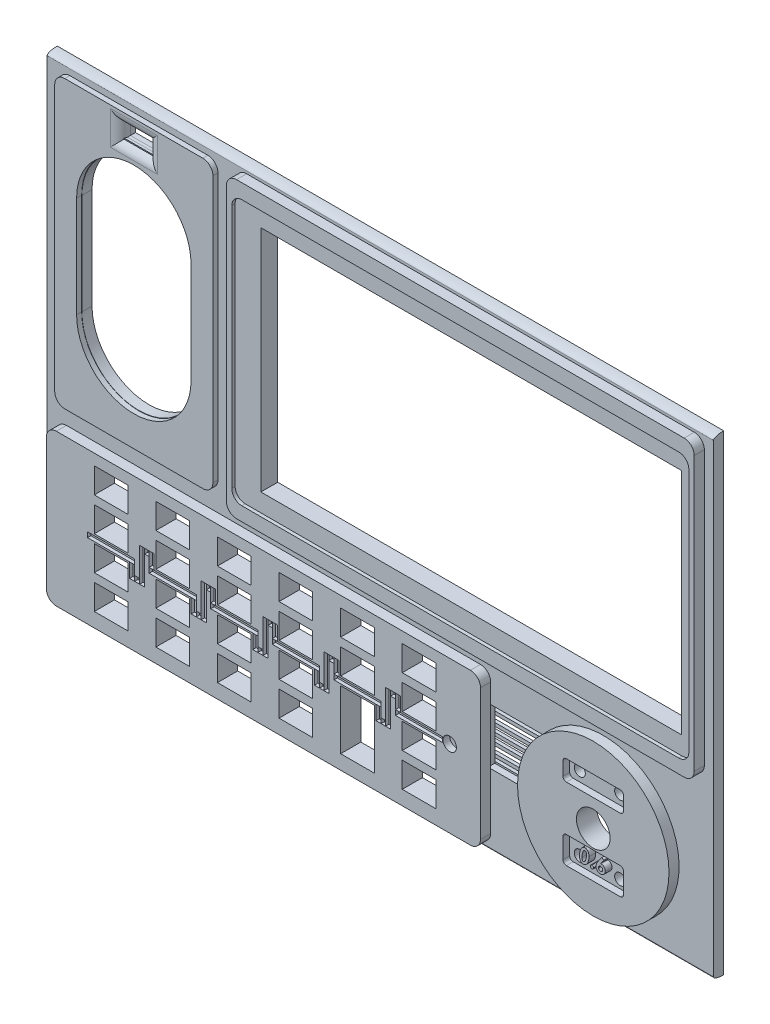
from build123d import *

# Parameters (mm, degrees)
SKETCH1_W                   = 198
SKETCH1_H                   = 140
MAIN_BODY_DEPTH             = 3
LONG_CORNERS_SIZE           = 3
LONG_CORNERS_SIZE_2         = 1
SKETCH2_W                   = 47
SKETCH2_H                   = 85
SPEAKER_DEPTH               = 1.5
SPEAKER_CORNERS_R           = 3
SPEAKER_CUT_DEPTH           = 122.331158548
SKETCH21_W                  = 43
SKETCH21_H                  = 72
SPEAKER_SLOT_DEPTH          = 3
SKETCH36_W                  = 43
SKETCH36_H                  = 0.5
SKETCH36_W_2                = 5.5
SKETCH36_W_3                = 3.5
SKETCH36_W_4                = 10
SPEAKER_PRINT_SUPPORT_DEPTH = 3
SKETCH3_W                   = 139
SKETCH3_H                   = 87.25
LCD_DEPTH                   = 3
LCD_CORNERS_R               = 3
SKETCH9_W                   = 135.8
SKETCH9_H                   = 78.75
LCD_FRONT_DEPTH             = 1
LCD_FRONT_CORNERS_R         = 3
SKETCH10_W                  = 125
SKETCH10_H                  = 68
LCD_BACK_DEPTH              = 122.396046203
SKETCH4_W                   = 129
SKETCH4_H                   = 45
KEYPAD_DEPTH                = 3
KEYPAD_CORNERS_R            = 3
SKETCH25_W                  = 10
SKETCH25_H                  = 7.5
SKETCH25_H_2                = 17.5
KEYPAD_CUTS_0_8_DEPTH       = 122.396046208
SKETCH5_R                   = 22.5
VFO_DEPTH                   = 3
SKETCH7_R                   = 5
VFO_ENCODER_KNOB_CUT_DEPTH  = 122.396046208
SKETCH37_W                  = 18
SKETCH37_H                  = 8
SKETCH37_H_2                = 6
LOGO_CUT_DEPTH              = 2
SKETCH44_R                  = 1.65
ENCODER_MOUNT_HOLES_DEPTH   = 122.396046208
ENC_CUT_CORNERS_R           = 1
LOGO_TXT_VER_DEPTH          = 2
ESP32_W                     = 18.5
ESP32_H                     = 16.5
ESP32_CAN_CUT_DEPTH         = 3
SKETCH43_W                  = 16.5
SKETCH43_H                  = 16.5
LORA_CUT_DEPTH              = 2.5
SKETCH47_W                  = 27
SKETCH47_H                  = 18.5
ESP32_EX_CUT_DEPTH          = 1
SKETCH49_W                  = 8
SKETCH49_H                  = 4
AMB_SENSOR_DEPTH            = 122.396046208
AMB_CORNERS_R               = 3
SKETCH50_W                  = 14
SKETCH50_H                  = 1.5
SKETCH50_W_2                = 1.5
SKETCH50_H_2                = 4.24
SKETCH50_H_3                = 10
SKETCH50_W_3                = 1.3
SKETCH50_W_4                = 1.45
SKETCH50_W_5                = 1.26
SKETCH50_W_6                = 1.46
LORA_ANT_DEPTH              = 1
SKETCH51_R                  = 0.5
LORA_ANT_PIN_DEPTH          = 122.396046208
SKETCH52_R                  = 2
LORA_ANT_SOLDER_DEPTH       = 2
SKETCH53_W                  = 26.5
SKETCH53_H                  = 1
ESP32_SUPPORT_DEPTH         = 1
SKETCH54_W                  = 15.995889497
SKETCH54_H                  = 0.898645477
SKETCH54_H_2                = 1.168239121
SKETCH54_H_3                = 1.033442299
SKETCH54_W_2                = 15.726295854
SKETCH54_H_4                = 1.078374573
SKETCH54_H_5                = 0.943577751
BOSS_EXTRUDE2_DEPTH         = 2.5
SKETCH55_W                  = 10
SKETCH55_H                  = 20
SKETCH55_W_2                = 22
SKETCH55_H_2                = 4
SKETCH55_W_3                = 4
SKETCH55_H_3                = 10
SKETCH55_W_4                = 3
SKETCH55_H_4                = 5
SKETCH55_W_5                = 14
SKETCH55_W_6                = 13
SKETCH55_H_5                = 3
SKETCH55_W_7                = 15
CONN_CUTOUTS_DEPTH          = 2


with BuildPart() as part:
    # Sketch1 → main_body (new body)
    with BuildSketch(Plane.XY):
        Rectangle(SKETCH1_W, SKETCH1_H)
    extrude(amount=MAIN_BODY_DEPTH)

    # long_corners
    # an asymmetric fillet: 3, 1 mm, written as the material it takes off along each edge
    with BuildSketch(Plane(origin=(-106.5, 70, 3), x_dir=(0, 0, -1), z_dir=(1, 0, 0)), Plane(origin=(106.5, -70, 3), x_dir=(0, 0, -1), z_dir=(-1, 0, 0))) as long_corners_piece_1:
        with BuildLine():
            Bezier((LONG_CORNERS_SIZE, 0), (0, 0), (0, -LONG_CORNERS_SIZE_2), weights=[1, 0.707106781, 1])
            Line((0, -LONG_CORNERS_SIZE_2), (0, 0))
            Line((0, 0), (LONG_CORNERS_SIZE, 0))
        make_face()
    extrude(amount=213, mode=Mode.SUBTRACT)

    # Sketch2 → speaker (add)
    with BuildSketch(Plane.XY.offset(3)):
        with Locations((-71.75, 24.75)):
            Rectangle(SKETCH2_W, SKETCH2_H)
    extrude(amount=SPEAKER_DEPTH)

    # speaker_corners
    speaker_corners_edges = [part.edges().sort_by_distance(p)[0] for p in [
        (-95.25, 67.25, 3.75),
        (-95.25, -17.75, 3.75),
        (-48.25, -17.75, 3.75),
        (-48.25, 67.25, 3.75),
    ]]
    fillet(speaker_corners_edges, radius=SPEAKER_CORNERS_R)

    # Sketch19 → speaker_cut (cut, through all)
    with BuildSketch(Plane.XY.offset(4.5)):
        with BuildLine():
            Line((-88.75, 8.25), (-88.75, 38.25))
            ThreePointArc((-88.75, 38.25), (-71.75, 55.25), (-54.75, 38.25))
            Line((-54.75, 38.25), (-54.75, 8.25))
            ThreePointArc((-54.75, 8.25), (-71.75, -8.75), (-88.75, 8.25))
        make_face()
    extrude(amount=-SPEAKER_CUT_DEPTH, mode=Mode.SUBTRACT)

    # Sketch21 → speaker_slot (cut)
    with BuildSketch(Plane(origin=(0, 0, 0), x_dir=(-1, 0, 0), z_dir=(0, 0, -1))):
        with Locations((71.75, 23.25)):
            Rectangle(SKETCH21_W, SKETCH21_H)
    extrude(amount=-SPEAKER_SLOT_DEPTH, mode=Mode.SUBTRACT)

    # Sketch36 → speaker_print_support (add)
    # profile 1 of 17: a face of its own
    with BuildSketch(Plane(origin=(0, 0, 3), x_dir=(-1, 0, 0), z_dir=(0, 0, -1))):
        with BuildLine():
            Line((54.25, 8.263862744), (54.25, 38.236137256))
            ThreePointArc((54.25, 38.236137256), (71.75, 55.736137256), (89.25, 38.236137256))
            Line((89.25, 38.236137256), (89.25, 8.263862744))
            ThreePointArc((89.25, 8.263862744), (71.75, -9.236137256), (54.25, 8.263862744))
        make_face()
        with BuildLine():
            Line((54.831583339, 8.263862744), (54.831583339, 38.236137256))
            ThreePointArc((54.831583339, 38.236137256), (71.75, 55.154553916), (88.668416661, 38.236137256))
            Line((88.668416661, 38.236137256), (88.668416661, 8.263862744))
            ThreePointArc((88.668416661, 8.263862744), (71.75, -8.654553916), (54.831583339, 8.263862744))
        make_face(mode=Mode.SUBTRACT)
    # profile 2 of 17: a face of its own
    with BuildSketch(Plane(origin=(0, 0, 3), x_dir=(-1, 0, 0), z_dir=(0, 0, -1))):
        with Locations((71.75, 57)):
            Rectangle(SKETCH36_W, SKETCH36_H)
    # profile 3 of 17: a face of its own
    with BuildSketch(Plane(origin=(0, 0, 3), x_dir=(-1, 0, 0), z_dir=(0, 0, -1))):
        with Locations((90.5, 0)):
            Rectangle(SKETCH36_W_2, SKETCH36_H)
    # profile 4 of 17: a face of its own
    with BuildSketch(Plane(origin=(0, 0, 3), x_dir=(-1, 0, 0), z_dir=(0, 0, -1))):
        with Locations((71.75, -10.5)):
            Rectangle(SKETCH36_W, SKETCH36_H)
    # profile 5 of 17: a face of its own
    with BuildSketch(Plane(origin=(0, 0, 3), x_dir=(-1, 0, 0), z_dir=(0, 0, -1))):
        with Locations((90.5, 46.5)):
            Rectangle(SKETCH36_W_2, SKETCH36_H)
    # profile 6 of 17: a face of its own
    with BuildSketch(Plane(origin=(0, 0, 3), x_dir=(-1, 0, 0), z_dir=(0, 0, -1))):
        with Locations((91.5, 35)):
            Rectangle(SKETCH36_W_3, SKETCH36_H)
    # profile 7 of 17: a face of its own
    with BuildSketch(Plane(origin=(0, 0, 3), x_dir=(-1, 0, 0), z_dir=(0, 0, -1))):
        with Locations((91.5, 23.5)):
            Rectangle(SKETCH36_W_3, SKETCH36_H)
    # profile 8 of 17: a face of its own
    with BuildSketch(Plane(origin=(0, 0, 3), x_dir=(-1, 0, 0), z_dir=(0, 0, -1))):
        with Locations((91.5, 11)):
            Rectangle(SKETCH36_W_3, SKETCH36_H)
    # profile 9 of 17: a face of its own
    with BuildSketch(Plane(origin=(0, 0, 3), x_dir=(-1, 0, 0), z_dir=(0, 0, -1))):
        with Locations((88.25, -5.5)):
            Rectangle(SKETCH36_W_4, SKETCH36_H)
    # profile 10 of 17: a face of its own
    with BuildSketch(Plane(origin=(0, 0, 3), x_dir=(-1, 0, 0), z_dir=(0, 0, -1))):
        with Locations((88.25, 52)):
            Rectangle(SKETCH36_W_4, SKETCH36_H)
    # profile 11 of 17: a face of its own
    with BuildSketch(Plane(origin=(0, 0, 3), x_dir=(-1, 0, 0), z_dir=(0, 0, -1))):
        with Locations((55.25, 52)):
            Rectangle(SKETCH36_W_4, SKETCH36_H)
    # profile 12 of 17: a face of its own
    with BuildSketch(Plane(origin=(0, 0, 3), x_dir=(-1, 0, 0), z_dir=(0, 0, -1))):
        with Locations((53, 46.5)):
            Rectangle(SKETCH36_W_2, SKETCH36_H)
    # profile 13 of 17: a face of its own
    with BuildSketch(Plane(origin=(0, 0, 3), x_dir=(-1, 0, 0), z_dir=(0, 0, -1))):
        with Locations((52, 35)):
            Rectangle(SKETCH36_W_3, SKETCH36_H)
    # profile 14 of 17: a face of its own
    with BuildSketch(Plane(origin=(0, 0, 3), x_dir=(-1, 0, 0), z_dir=(0, 0, -1))):
        with Locations((52, 23.5)):
            Rectangle(SKETCH36_W_3, SKETCH36_H)
    # profile 15 of 17: a face of its own
    with BuildSketch(Plane(origin=(0, 0, 3), x_dir=(-1, 0, 0), z_dir=(0, 0, -1))):
        with Locations((52, 10.5)):
            Rectangle(SKETCH36_W_3, SKETCH36_H)
    # profile 16 of 17: a face of its own
    with BuildSketch(Plane(origin=(0, 0, 3), x_dir=(-1, 0, 0), z_dir=(0, 0, -1))):
        with Locations((53, 0)):
            Rectangle(SKETCH36_W_2, SKETCH36_H)
    # profile 17 of 17: a face of its own
    with BuildSketch(Plane(origin=(0, 0, 3), x_dir=(-1, 0, 0), z_dir=(0, 0, -1))):
        with Locations((55.25, -5.5)):
            Rectangle(SKETCH36_W_4, SKETCH36_H)
    extrude(amount=SPEAKER_PRINT_SUPPORT_DEPTH)

    # Sketch3 → lcd (add)
    with BuildSketch(Plane.XY.offset(3)):
        with Locations((26.75, 24.625)):
            Rectangle(SKETCH3_W, SKETCH3_H)
    extrude(amount=LCD_DEPTH)

    # lcd_corners
    lcd_corners_edges = [part.edges().sort_by_distance(p)[0] for p in [
        (-42.75, 68.25, 4.5),
        (-42.75, -19, 4.5),
        (96.25, -19, 4.5),
        (96.25, 68.25, 4.5),
    ]]
    fillet(lcd_corners_edges, radius=LCD_CORNERS_R)

    # Sketch9 → lcd_front (cut)
    with BuildSketch(Plane.XY.offset(6)):
        with Locations((26.75, 24.5)):
            Rectangle(SKETCH9_W, SKETCH9_H)
    extrude(amount=-LCD_FRONT_DEPTH, mode=Mode.SUBTRACT)

    # lcd_front_corners
    lcd_front_corners_edges = [part.edges().sort_by_distance(p)[0] for p in [
        (-41.15, -14.875, 5.5),
        (-41.15, 63.875, 5.5),
        (94.65, 63.875, 5.5),
        (94.65, -14.875, 5.5),
    ]]
    fillet(lcd_front_corners_edges, radius=LCD_FRONT_CORNERS_R)

    # Sketch10 → lcd_back (cut, through all)
    with BuildSketch(Plane(origin=(0, 0, 0), x_dir=(-1, 0, 0), z_dir=(0, 0, -1))):
        with Locations((-29, 24.5)):
            Rectangle(SKETCH10_W, SKETCH10_H)
    extrude(amount=-LCD_BACK_DEPTH, mode=Mode.SUBTRACT)

    # Sketch4 → keypad (add)
    with BuildSketch(Plane.XY.offset(3)):
        with Locations((-31.75, -45.75)):
            Rectangle(SKETCH4_W, SKETCH4_H)
    extrude(amount=KEYPAD_DEPTH)

    # keypad_corners
    keypad_corners_edges = [part.edges().sort_by_distance(p)[0] for p in [
        (-96.25, -23.25, 4.5),
        (-96.25, -68.25, 4.5),
        (32.75, -68.25, 4.5),
        (32.75, -23.25, 4.5),
    ]]
    fillet(keypad_corners_edges, radius=KEYPAD_CORNERS_R)

    # Sketch25 → keypad_cuts_0.8 (cut, through all)
    with BuildSketch(Plane.XY.offset(6)):
        with Locations((-77, -30.25)):
            Rectangle(SKETCH25_W, SKETCH25_H)
        with Locations((-77, -40.25)):
            Rectangle(SKETCH25_W, SKETCH25_H)
        with Locations((-77, -50.25)):
            Rectangle(SKETCH25_W, SKETCH25_H)
        with Locations((-77, -60.25)):
            Rectangle(SKETCH25_W, SKETCH25_H)
        with Locations((-58.7, -30.25)):
            Rectangle(SKETCH25_W, SKETCH25_H)
        with Locations((-58.7, -40.25)):
            Rectangle(SKETCH25_W, SKETCH25_H)
        with Locations((-58.7, -50.25)):
            Rectangle(SKETCH25_W, SKETCH25_H)
        with Locations((-58.7, -60.25)):
            Rectangle(SKETCH25_W, SKETCH25_H)
        with Locations((-40.4, -30.25)):
            Rectangle(SKETCH25_W, SKETCH25_H)
        with Locations((-40.4, -40.25)):
            Rectangle(SKETCH25_W, SKETCH25_H)
        with Locations((-40.4, -50.25)):
            Rectangle(SKETCH25_W, SKETCH25_H)
        with Locations((-40.4, -60.25)):
            Rectangle(SKETCH25_W, SKETCH25_H)
        with Locations((-22.1, -30.25)):
            Rectangle(SKETCH25_W, SKETCH25_H)
        with Locations((-22.1, -40.25)):
            Rectangle(SKETCH25_W, SKETCH25_H)
        with Locations((-22.1, -50.25)):
            Rectangle(SKETCH25_W, SKETCH25_H)
        with Locations((-22.1, -60.25)):
            Rectangle(SKETCH25_W, SKETCH25_H)
        with Locations((-3.8, -30.25)):
            Rectangle(SKETCH25_W, SKETCH25_H)
        with Locations((14.5, -30.25)):
            Rectangle(SKETCH25_W, SKETCH25_H)
        with Locations((-3.8, -40.25)):
            Rectangle(SKETCH25_W, SKETCH25_H)
        with Locations((14.5, -40.25)):
            Rectangle(SKETCH25_W, SKETCH25_H)
        with Locations((14.5, -50.25)):
            Rectangle(SKETCH25_W, SKETCH25_H)
        with Locations((14.5, -60.25)):
            Rectangle(SKETCH25_W, SKETCH25_H)
        with Locations((-3.8, -55.25)):
            Rectangle(SKETCH25_W, SKETCH25_H_2)
    extrude(amount=-KEYPAD_CUTS_0_8_DEPTH, mode=Mode.SUBTRACT)

    # Sketch5 → vfo (add)
    with BuildSketch(Plane.XY.offset(3)):
        with Locations((66.25, -45.75)):
            Circle(SKETCH5_R)
    extrude(amount=VFO_DEPTH)

    # Sketch7 → vfo_encoder_knob_cut (cut, through all)
    with BuildSketch(Plane.XY.offset(6)):
        with Locations((66.25, -45.75)):
            Circle(SKETCH7_R)
    extrude(amount=-VFO_ENCODER_KNOB_CUT_DEPTH, mode=Mode.SUBTRACT)

    # Sketch37 → logo_cut (cut)
    with BuildSketch(Plane.XY.offset(6)):
        with Locations((66.25, -55.25)):
            Rectangle(SKETCH37_W, SKETCH37_H)
        with Locations((66.25, -34.75)):
            Rectangle(SKETCH37_W, SKETCH37_H_2)
    extrude(amount=-LOGO_CUT_DEPTH, mode=Mode.SUBTRACT)

    # Sketch44 → encoder_mount_holes (cut, through all)
    with BuildSketch(Plane.XY.offset(6)):
        with Locations((60.25, -34.75)):
            Circle(SKETCH44_R)
        with Locations((72.25, -34.75)):
            Circle(SKETCH44_R)
        with Locations((60.25, -56.75)):
            Circle(SKETCH44_R)
        with Locations((72.25, -56.75)):
            Circle(SKETCH44_R)
    extrude(amount=-ENCODER_MOUNT_HOLES_DEPTH, mode=Mode.SUBTRACT)

    # enc_cut_corners
    enc_cut_corners_edges = [part.edges().sort_by_distance(p)[0] for p in [
        (57.25, -59.25, 5),
        (57.25, -51.25, 5),
        (75.25, -51.25, 5),
        (75.25, -59.25, 5),
        (57.25, -37.75, 5),
        (57.25, -31.75, 5),
        (75.25, -31.75, 5),
        (75.25, -37.75, 5),
    ]]
    fillet(enc_cut_corners_edges, radius=ENC_CUT_CORNERS_R)

    # Sketch39 → logo_txt_ver (add)
    # profile 1 of 3: a face of its own
    with BuildSketch(Plane.XY.offset(4)):
        with BuildLine():
            add(Edge.make_bspline(
                [(63.848691239, -51.908119658), (63.888365435, -51.909349684), (63.966554937, -51.911773806), (64.080877258, -51.933207937), (64.190733796, -51.965674637), (64.294601546, -52.014500361), (64.394862397, -52.074304909), (64.488096326, -52.150498068), (64.577717446, -52.238076119), (64.661431722, -52.339093675), (64.73820927, -52.452802479), (64.804033758, -52.58032325), (64.861076095, -52.719494062), (64.906353871, -52.871317336), (64.94204881, -53.03516432), (64.966836856, -53.211477353), (64.98235384, -53.400079429), (64.98412922, -53.529791568), (64.985042735, -53.596534455)],
                knots=[0, 0, 0, 0, 0.836471817, 1.648510141, 2.446693269, 3.247435573, 4.063800371, 4.904091908, 5.781463953, 6.704836402, 7.667709944, 8.670923685, 9.727683881, 10.837250621, 12.009625467, 13.263198326, 14.591789123, 16, 16, 16, 16], degree=3))
            add(Edge.make_bspline(
                [(64.985042735, -53.596534455), (64.984174572, -53.666370949), (64.982461587, -53.804166197), (64.970481381, -54.008180602), (64.950288624, -54.206546546), (64.921596443, -54.399301642), (64.884068156, -54.585982433), (64.839324723, -54.767243461), (64.785837932, -54.942655582), (64.724978433, -55.111503534), (64.658749521, -55.271532851), (64.587347336, -55.420711894), (64.511787847, -55.55768062), (64.434314896, -55.684436883), (64.350866864, -55.79768252), (64.265002546, -55.900444521), (64.175503308, -55.991790177), (64.080520101, -56.069760883), (63.983783828, -56.137534526), (63.885553457, -56.196701246), (63.785566844, -56.24684125), (63.683485726, -56.287848769), (63.579770974, -56.318994939), (63.474711236, -56.342367403), (63.367674722, -56.356281986), (63.295537188, -56.357789862), (63.259314904, -56.358547009)],
                knots=[0, 0, 0, 0, 1.396844559, 2.756131219, 4.086127259, 5.383920942, 6.652453196, 7.89349539, 9.116895717, 10.318757433, 11.482194025, 12.579741648, 13.624829685, 14.610133714, 15.548779577, 16.435605836, 17.287197802, 18.102347136, 18.889788549, 19.648068299, 20.394000194, 21.124756219, 21.84557971, 22.557590164, 23.275725456, 24, 24, 24, 24], degree=3))
            add(Edge.make_bspline(
                [(63.259314904, -56.358547009), (63.208533793, -56.35647876), (63.10901656, -56.352425552), (62.963870994, -56.318807794), (62.827327459, -56.264416384), (62.721552329, -56.201013431), (62.642419132, -56.140242954), (62.58617758, -56.088170731), (62.531136385, -56.032604476), (62.481164555, -55.969803388), (62.434131788, -55.902064152), (62.388549016, -55.829795197), (62.347333829, -55.751657596), (62.309079142, -55.66816717), (62.273810607, -55.579015408), (62.244659363, -55.482715366), (62.218836075, -55.38007977), (62.19944846, -55.270551537), (62.181510627, -55.15507113), (62.171433221, -55.032661571), (62.164340983, -54.903988413), (62.163334684, -54.816003271), (62.162820513, -54.771047009)],
                knots=[0, 0, 0, 0, 1.406247179, 2.755863859, 4.106117258, 5.46602111, 6.158742467, 6.868709005, 7.589063128, 8.324514997, 9.089670002, 9.87455016, 10.69128516, 11.536247762, 12.419471489, 13.346380782, 14.323181077, 15.351303999, 16.428392134, 17.561291642, 18.753934945, 20, 20, 20, 20], degree=3))
            add(Edge.make_bspline(
                [(62.162820513, -54.771047009), (62.163691924, -54.694992868), (62.165413133, -54.544770822), (62.177349278, -54.322682824), (62.197456041, -54.107067411), (62.226542677, -53.898345461), (62.262517914, -53.69615929), (62.307892342, -53.501069611), (62.359740315, -53.311965291), (62.402138798, -53.189836029), (62.423163729, -53.129273504)],
                knots=[0, 0, 0, 0, 1.092573637, 2.158050095, 3.194115651, 4.202596009, 5.184740479, 6.143227219, 7.07924729, 8, 8, 8, 8], degree=3))
            add(Edge.make_bspline(
                [(62.423163729, -53.129273504), (62.442922042, -53.078142911), (62.481557924, -52.978160915), (62.548197376, -52.83576491), (62.618144282, -52.703254639), (62.692798479, -52.581632517), (62.771864603, -52.470600931), (62.855722614, -52.370431419), (62.94433066, -52.280583332), (63.037557245, -52.201936501), (63.133955258, -52.133369167), (63.231112131, -52.072458265), (63.331123556, -52.022566979), (63.431867538, -51.980728772), (63.533998266, -51.948238298), (63.637614577, -51.925497208), (63.742509435, -51.910125722), (63.813302956, -51.908788239), (63.848691239, -51.908119658)],
                knots=[0, 0, 0, 0, 1.312439913, 2.566376662, 3.7626465, 4.899353607, 5.981447343, 7.024199363, 8.024692673, 8.999854102, 9.941079975, 10.856034809, 11.7431154, 12.614348406, 13.466487218, 14.305782657, 15.153094213, 16, 16, 16, 16], degree=3))
        make_face()
        with BuildLine():
            add(Edge.make_bspline(
                [(63.769825053, -52.613675214), (63.742163324, -52.615483738), (63.686272422, -52.619137885), (63.605048954, -52.649198462), (63.527037133, -52.69684215), (63.481579172, -52.740200888), (63.457752404, -52.76292735)],
                knots=[0, 0, 0, 0, 0.932167559, 1.883457255, 2.89061511, 4, 4, 4, 4], degree=3))
            add(Edge.make_bspline(
                [(63.457752404, -52.76292735), (63.440032967, -52.782909494), (63.402730156, -52.824975735), (63.354006843, -52.898903592), (63.303903675, -52.981940652), (63.258168438, -53.077658648), (63.212433698, -53.183758856), (63.167048801, -53.300849127), (63.125712065, -53.429830058), (63.069586693, -53.615525951), (63.010767888, -53.858175784), (62.959870027, -54.157067094), (62.928442295, -54.461691203), (62.92458826, -54.666948705), (62.922649573, -54.770198985)],
                knots=[0, 0, 0, 0, 0.454841493, 0.957528522, 1.506411314, 2.107825232, 2.764136245, 3.476658851, 4.247912131, 5.07291354, 6.784378205, 8.500722671, 10.239765365, 12, 12, 12, 12], degree=3))
            add(Edge.make_bspline(
                [(62.922649573, -54.770198985), (62.922985961, -54.811471553), (62.923631369, -54.890658821), (62.92818185, -55.00415616), (62.938108319, -55.107305303), (62.948989025, -55.200338494), (62.965066439, -55.282784596), (62.984593381, -55.354787422), (63.006718198, -55.416810357), (63.033649431, -55.469011748), (63.063481391, -55.512753852), (63.096627784, -55.549925555), (63.131478827, -55.582090818), (63.169899037, -55.608026338), (63.210171565, -55.628719968), (63.253950094, -55.641802189), (63.299539434, -55.652131225), (63.331333287, -55.652701373), (63.347509348, -55.652991453)],
                knots=[0, 0, 0, 0, 1.809169144, 3.47114723, 4.976568932, 6.350508084, 7.575216927, 8.654321082, 9.618705548, 10.455493865, 11.22189838, 11.932917759, 12.63470061, 13.29454068, 13.959479695, 14.609946561, 15.292769288, 16, 16, 16, 16], degree=3))
            add(Edge.make_bspline(
                [(63.347509348, -55.652991453), (63.378076919, -55.650557474), (63.441468895, -55.645509813), (63.535374021, -55.606353512), (63.628611442, -55.544532168), (63.705842198, -55.476278007), (63.767783881, -55.407656763), (63.812961514, -55.341483264), (63.857873246, -55.264510613), (63.902934861, -55.176831049), (63.94467859, -55.076506155), (63.987269993, -54.965522672), (64.028567924, -54.842738526), (64.081991848, -54.662288429), (64.140816138, -54.422832591), (64.188991997, -54.121640423), (64.219478184, -53.807473532), (64.223279186, -53.593496993), (64.225213675, -53.484595353)],
                knots=[0, 0, 0, 0, 0.585084729, 1.213366824, 1.923217654, 2.726038827, 3.183054462, 3.692969635, 4.259263019, 4.892137045, 5.581993971, 6.3422359, 7.172083011, 8.065836625, 9.951587279, 11.896519821, 13.911566738, 16, 16, 16, 16], degree=3))
            add(Edge.make_bspline(
                [(64.225213675, -53.484595353), (64.224958326, -53.446993862), (64.224464556, -53.374283497), (64.218738811, -53.269543511), (64.208182976, -53.173144057), (64.195703978, -53.084764023), (64.17621827, -53.00525762), (64.156122348, -52.933166479), (64.129506801, -52.870339855), (64.099710526, -52.815162338), (64.066428749, -52.767860046), (64.031799451, -52.726325829), (63.993657165, -52.692206156), (63.954089166, -52.66288983), (63.91117737, -52.640515815), (63.865866223, -52.625508866), (63.818579797, -52.615678268), (63.786269784, -52.614350834), (63.769825053, -52.613675214)],
                knots=[0, 0, 0, 0, 1.651300251, 3.193135231, 4.60384893, 5.910135154, 7.108621979, 8.196635245, 9.19265296, 10.098222774, 10.945408105, 11.729089381, 12.467301952, 13.187443458, 13.887068836, 14.581941946, 15.278255209, 16, 16, 16, 16], degree=3))
        make_face(mode=Mode.SUBTRACT)
    # profile 2 of 3: a face of its own
    with BuildSketch(Plane.XY.offset(4)):
        with BuildLine():
            add(Edge.make_bspline(
                [(65.853418803, -55.327350427), (65.885860205, -55.328749622), (65.949690465, -55.331502616), (66.040977262, -55.360284524), (66.125501637, -55.405091602), (66.199461405, -55.467808756), (66.262539921, -55.541888189), (66.309371798, -55.625756041), (66.336499223, -55.718633268), (66.340054883, -55.782845642), (66.341880342, -55.815811966)],
                knots=[0, 0, 0, 0, 1.011829643, 1.990831015, 2.96394547, 3.98733706, 5.003945692, 5.993273531, 6.969756284, 8, 8, 8, 8], degree=3))
            add(Edge.make_bspline(
                [(66.341880342, -55.815811966), (66.340004814, -55.848203659), (66.336320726, -55.911830453), (66.309417785, -56.004212153), (66.262263056, -56.088074019), (66.199819199, -56.16304445), (66.125194451, -56.225384828), (66.041402578, -56.27183897), (65.949448779, -56.298734855), (65.885814372, -56.302405049), (65.853418803, -56.304273504)],
                knots=[0, 0, 0, 0, 1.013694729, 1.991193998, 2.981551723, 4.006008661, 5.030465598, 6.008806002, 6.986305271, 8, 8, 8, 8], degree=3))
            add(Edge.make_bspline(
                [(65.853418803, -56.304273504), (65.820747588, -56.302393941), (65.756571653, -56.298701922), (65.663952646, -56.27204111), (65.579983551, -56.225336275), (65.505335731, -56.163287881), (65.443640506, -56.088018271), (65.397562801, -56.003994016), (65.370469779, -55.911852992), (65.366816903, -55.848211263), (65.364957265, -55.815811966)],
                knots=[0, 0, 0, 0, 1.02155614, 2.006638561, 2.984070978, 4.007577129, 5.025452526, 6.010654007, 6.987246069, 8, 8, 8, 8], degree=3))
            add(Edge.make_bspline(
                [(65.364957265, -55.815811966), (65.366766403, -55.782837869), (65.370290275, -55.718610354), (65.397608888, -55.625973794), (65.443365245, -55.541948117), (65.505694295, -55.467562161), (65.579676777, -55.40514169), (65.664377241, -55.360082504), (65.756331099, -55.331533699), (65.820701823, -55.328760122), (65.853418803, -55.327350427)],
                knots=[0, 0, 0, 0, 1.029295292, 2.004879113, 2.989063463, 3.999073543, 5.021523017, 5.993741641, 6.980301721, 8, 8, 8, 8], degree=3))
        make_face()
    # profile 3 of 3: a face of its own
    with BuildSketch(Plane.XY.offset(4)):
        with BuildLine():
            Line((68.790124199, -51.908119658), (69.388828793, -52.304994658))
            Line((69.388828793, -52.304994658), (68.38137687, -53.68727297))
            add(Edge.make_bspline(
                [(68.38137687, -53.68727297), (68.405615517, -53.680756536), (68.452934727, -53.668035012), (68.522878854, -53.654493815), (68.589519299, -53.646491294), (68.632654696, -53.645401012), (68.653592415, -53.644871795)],
                knots=[0, 0, 0, 0, 1.089609887, 2.127159907, 3.090932268, 4, 4, 4, 4], degree=3))
            add(Edge.make_bspline(
                [(68.653592415, -53.644871795), (68.692938257, -53.646070482), (68.770586241, -53.648436059), (68.884738696, -53.66545063), (68.994185638, -53.694996698), (69.100088883, -53.73411505), (69.200224905, -53.788222721), (69.297688524, -53.850445366), (69.389601959, -53.926102356), (69.475834675, -54.01184797), (69.555411035, -54.10545722), (69.625495157, -54.205726271), (69.683768192, -54.312379857), (69.732934265, -54.423550288), (69.768823774, -54.541082092), (69.796396513, -54.663424438), (69.812720671, -54.791806102), (69.81448726, -54.879265428), (69.815384615, -54.923691239)],
                knots=[0, 0, 0, 0, 0.981674988, 1.937309752, 2.8714621, 3.806811995, 4.747016197, 5.705665753, 6.688303193, 7.71076465, 8.736723538, 9.750265914, 10.757357402, 11.765041529, 12.777847337, 13.818324041, 14.891796593, 16, 16, 16, 16], degree=3))
            add(Edge.make_bspline(
                [(69.815384615, -54.923691239), (69.814445934, -54.973797288), (69.812598191, -55.072428306), (69.791979591, -55.217089547), (69.761158092, -55.355792255), (69.717127791, -55.488239758), (69.658560442, -55.613296936), (69.589159109, -55.732774255), (69.505985718, -55.845231646), (69.411800136, -55.950360369), (69.30789994, -56.046240913), (69.195480835, -56.129599126), (69.076161055, -56.200438852), (68.949942006, -56.258363252), (68.81666841, -56.303531996), (68.676357796, -56.335755588), (68.528867774, -56.354371601), (68.428352958, -56.357137616), (68.377136752, -56.358547009)],
                knots=[0, 0, 0, 0, 1.056799255, 2.080251592, 3.077440699, 4.052814811, 5.019096721, 5.987053154, 6.964322968, 7.965626122, 8.962101115, 9.942915494, 10.913900785, 11.885600608, 12.868535592, 13.878686228, 14.919108164, 16, 16, 16, 16], degree=3))
            add(Edge.make_bspline(
                [(68.377136752, -56.358547009), (68.330417552, -56.357566321), (68.238570173, -56.355638344), (68.104208169, -56.335693253), (67.97521237, -56.307362807), (67.85343591, -56.26259714), (67.736431101, -56.209158946), (67.626555391, -56.140852413), (67.521880566, -56.062194722), (67.424865146, -55.971383524), (67.336651291, -55.872266573), (67.258836153, -55.766983058), (67.193787241, -55.655384865), (67.140563108, -55.538569838), (67.098447072, -55.4162321), (67.06908913, -55.288616588), (67.050664177, -55.155457022), (67.048524767, -55.064806952), (67.047435897, -55.018669872)],
                knots=[0, 0, 0, 0, 1.063306671, 2.090402461, 3.088389398, 4.065895744, 5.03947144, 6.013408992, 7.006231883, 8.017587523, 9.034563496, 10.024857058, 10.99440066, 11.971122141, 12.944378439, 13.936094236, 14.949558597, 16, 16, 16, 16], degree=3))
            add(Edge.make_bspline(
                [(67.047435897, -55.018669872), (67.047996411, -54.981325038), (67.049111444, -54.907034724), (67.060858925, -54.796905474), (67.07805933, -54.688220324), (67.096068898, -54.617438165), (67.105101496, -54.581937767)],
                knots=[0, 0, 0, 0, 1.013987145, 2.017131071, 3.005503137, 4, 4, 4, 4], degree=3))
            add(Edge.make_bspline(
                [(67.105101496, -54.581937767), (67.120307312, -54.531973229), (67.150757454, -54.431917616), (67.207647485, -54.285807995), (67.269732824, -54.141418314), (67.318208653, -54.048528906), (67.342548077, -54.00188969)],
                knots=[0, 0, 0, 0, 0.997821065, 1.99816917, 2.994892707, 4, 4, 4, 4], degree=3))
            add(Edge.make_bspline(
                [(67.342548077, -54.00188969), (67.387307784, -53.923875635), (67.475597174, -53.769991397), (67.614100877, -53.547461739), (67.753655383, -53.334588309), (67.850903771, -53.198778013), (67.898851496, -53.131817575)],
                knots=[0, 0, 0, 0, 1.04448181, 2.060260654, 3.043623333, 4, 4, 4, 4], degree=3))
            Line((67.898851496, -53.131817575), (68.790124199, -51.908119658))
        make_face()
        with BuildLine():
            add(Edge.make_bspline(
                [(68.458547009, -54.35042735), (68.436464394, -54.351118765), (68.392949498, -54.352481232), (68.329038012, -54.362085667), (68.267647805, -54.377296705), (68.208476792, -54.398741106), (68.151545549, -54.42639443), (68.098216727, -54.462190644), (68.045753928, -54.50172853), (67.997458188, -54.548329027), (67.952565202, -54.598342598), (67.914377961, -54.65254885), (67.881041993, -54.708474773), (67.85348946, -54.76711982), (67.83361059, -54.828850836), (67.817717251, -54.892474492), (67.809632165, -54.959104034), (67.808062087, -55.004236371), (67.807264957, -55.027150107)],
                knots=[0, 0, 0, 0, 1.014927894, 1.999966114, 2.964388399, 3.918070091, 4.888601346, 5.865376255, 6.86606178, 7.904753609, 8.945069918, 9.95114094, 10.947344562, 11.935720019, 12.921957522, 13.924244887, 14.946136915, 16, 16, 16, 16], degree=3))
            add(Edge.make_bspline(
                [(67.807264957, -55.027150107), (67.809177306, -55.0695299), (67.812898633, -55.151998704), (67.848169848, -55.270101807), (67.902295761, -55.379071146), (67.967402471, -55.45807247), (68.026898365, -55.514508158), (68.074759489, -55.551724506), (68.125628732, -55.582539385), (68.178445115, -55.608063519), (68.23394692, -55.628863955), (68.292333304, -55.642897702), (68.353115988, -55.651801817), (68.394348007, -55.65259065), (68.41529781, -55.652991453)],
                knots=[0, 0, 0, 0, 1.565545665, 3.046467861, 4.525724499, 6.044378357, 6.807052655, 7.560767602, 8.28422068, 9.005170584, 9.730438725, 10.474276855, 11.22478697, 12, 12, 12, 12], degree=3))
            add(Edge.make_bspline(
                [(68.41529781, -55.652991453), (68.437378415, -55.652284268), (68.481169111, -55.650881765), (68.545383219, -55.641415662), (68.606801169, -55.626242712), (68.665425126, -55.604721618), (68.721163318, -55.576828527), (68.774158892, -55.542474943), (68.824351735, -55.502349211), (68.871692294, -55.456826446), (68.914421483, -55.406419161), (68.952141283, -55.35244433), (68.984323646, -55.295714436), (69.011009239, -55.236239445), (69.030338144, -55.17344134), (69.044515199, -55.108189375), (69.054611232, -55.040180077), (69.055237846, -54.99383211), (69.055555556, -54.970332532)],
                knots=[0, 0, 0, 0, 1.015362308, 2.013686703, 2.978521784, 3.920399249, 4.879700613, 5.838913883, 6.819559865, 7.830919415, 8.854653081, 9.853654421, 10.855021465, 11.850293911, 12.845311604, 13.87044759, 14.920263669, 16, 16, 16, 16], degree=3))
            add(Edge.make_bspline(
                [(69.055555556, -54.970332532), (69.053464255, -54.927728696), (69.04941526, -54.845242871), (69.017131041, -54.726766953), (68.9627042, -54.61990777), (68.900348466, -54.541316674), (68.841958258, -54.486932326), (68.796161538, -54.449528205), (68.746287391, -54.419137013), (68.694277816, -54.393393548), (68.638691111, -54.375045617), (68.581303291, -54.360276804), (68.520712097, -54.351670563), (68.479491173, -54.350846204), (68.458547009, -54.35042735)],
                knots=[0, 0, 0, 0, 1.5941063, 3.086369337, 4.558971602, 6.058727847, 6.815210494, 7.546067727, 8.268827637, 8.998072599, 9.714601704, 10.45672229, 11.215867575, 12, 12, 12, 12], degree=3))
        make_face(mode=Mode.SUBTRACT)
    extrude(amount=LOGO_TXT_VER_DEPTH)

    # esp32 → esp32_can_cut (cut)
    with BuildSketch(Plane(origin=(0, 0, 0), x_dir=(-1, 0, 0), z_dir=(0, 0, -1))):
        with Locations((-41.25, -40.3)):
            Rectangle(ESP32_W, ESP32_H)
    extrude(amount=-ESP32_CAN_CUT_DEPTH, mode=Mode.SUBTRACT)

    # Sketch43 → lora_cut (cut)
    with BuildSketch(Plane(origin=(0, 0, 0), x_dir=(-1, 0, 0), z_dir=(0, 0, -1))):
        with Locations((-42.25, -58.75)):
            Rectangle(SKETCH43_W, SKETCH43_H)
    extrude(amount=-LORA_CUT_DEPTH, mode=Mode.SUBTRACT)

    # Sketch47 → esp32_ex_cut (cut)
    with BuildSketch(Plane(origin=(0, 0, 0), x_dir=(-1, 0, 0), z_dir=(0, 0, -1))):
        with Locations((-44.5, -40.3)):
            Rectangle(SKETCH47_W, SKETCH47_H)
    extrude(amount=-ESP32_EX_CUT_DEPTH, mode=Mode.SUBTRACT)

    # Sketch49 → amb_sensor (cut, through all)
    with BuildSketch(Plane(origin=(0, 0, 0), x_dir=(-1, 0, 0), z_dir=(0, 0, -1))):
        with Locations((71.75, 61.35)):
            Rectangle(SKETCH49_W, SKETCH49_H)
    extrude(amount=-AMB_SENSOR_DEPTH, mode=Mode.SUBTRACT)

    # amb_corners
    amb_corners_edges = [part.edges().sort_by_distance(p)[0] for p in [
        (-71.75, 59.35, 4.5),
        (-75.75, 61.35, 4.5),
        (-71.75, 63.35, 4.5),
        (-67.75, 61.35, 4.5),
    ]]
    fillet(amb_corners_edges, radius=AMB_CORNERS_R)

    # Sketch50 → lora_ant (cut)
    with BuildSketch(Plane.XY.offset(6)):
        with Locations((-77, -45.25)):
            Rectangle(SKETCH50_W, SKETCH50_H)
        with Locations((-58.7, -45.25)):
            Rectangle(SKETCH50_W, SKETCH50_H)
        with Locations((-40.4, -45.25)):
            Rectangle(SKETCH50_W, SKETCH50_H)
        with Locations((-22.1, -45.25)):
            Rectangle(SKETCH50_W, SKETCH50_H)
        with Locations((-3.8, -45.25)):
            Rectangle(SKETCH50_W, SKETCH50_H)
        with Locations((14.5, -45.25)):
            Rectangle(SKETCH50_W, SKETCH50_H)
        with Locations((8.24, -42.37)):
            Rectangle(SKETCH50_W_2, SKETCH50_H_2)
        with Locations((2.45, -48.13)):
            Rectangle(SKETCH50_W_2, SKETCH50_H_2)
        with Locations((5.27, -45.25)):
            Rectangle(SKETCH50_W_2, SKETCH50_H_3)
        with Locations((3.86, -49.5)):
            Rectangle(SKETCH50_W_3, SKETCH50_H)
        with Locations((6.755, -41)):
            Rectangle(SKETCH50_W_4, SKETCH50_H)
        with Locations((-13.03, -45.25)):
            Rectangle(SKETCH50_W_2, SKETCH50_H_3)
        with Locations((-31.13, -45.25)):
            Rectangle(SKETCH50_W_2, SKETCH50_H_3)
        with Locations((-49.48, -45.25)):
            Rectangle(SKETCH50_W_2, SKETCH50_H_3)
        with Locations((-67.78, -45.25)):
            Rectangle(SKETCH50_W_2, SKETCH50_H_3)
        with Locations((-70.75, -48.13)):
            Rectangle(SKETCH50_W_2, SKETCH50_H_2)
        with Locations((-69.265, -49.5)):
            Rectangle(SKETCH50_W_4, SKETCH50_H)
        with Locations((-66.37, -41)):
            Rectangle(SKETCH50_W_3, SKETCH50_H)
        with Locations((-64.96, -42.37)):
            Rectangle(SKETCH50_W_2, SKETCH50_H_2)
        with Locations((-52.45, -48.13)):
            Rectangle(SKETCH50_W_2, SKETCH50_H_2)
        with Locations((-50.965, -49.5)):
            Rectangle(SKETCH50_W_4, SKETCH50_H)
        with Locations((-48.07, -41)):
            Rectangle(SKETCH50_W_3, SKETCH50_H)
        with Locations((-46.66, -42.37)):
            Rectangle(SKETCH50_W_2, SKETCH50_H_2)
        with Locations((-34.15, -48.13)):
            Rectangle(SKETCH50_W_2, SKETCH50_H_2)
        with Locations((-32.64, -49.5)):
            Rectangle(SKETCH50_W_2, SKETCH50_H)
        with Locations((-29.74, -41)):
            Rectangle(SKETCH50_W_5, SKETCH50_H)
        with Locations((-28.35, -42.37)):
            Rectangle(SKETCH50_W_2, SKETCH50_H_2)
        with Locations((-15.85, -48.13)):
            Rectangle(SKETCH50_W_2, SKETCH50_H_2)
        with Locations((-14.44, -49.5)):
            Rectangle(SKETCH50_W_3, SKETCH50_H)
        with Locations((-11.54, -41)):
            Rectangle(SKETCH50_W_6, SKETCH50_H)
        with Locations((-10.05, -42.37)):
            Rectangle(SKETCH50_W_2, SKETCH50_H_2)
    extrude(amount=-LORA_ANT_DEPTH, mode=Mode.SUBTRACT)

    # Sketch51 → lora_ant_pin (cut, through all)
    with BuildSketch(Plane.XY.offset(6)):
        with Locations((23.6, -45.25)):
            Circle(SKETCH51_R)
    extrude(amount=-LORA_ANT_PIN_DEPTH, mode=Mode.SUBTRACT)

    # Sketch52 → lora_ant_solder (cut)
    with BuildSketch(Plane.XY.offset(6)):
        with Locations((23.6, -45.25)):
            Circle(SKETCH52_R)
    extrude(amount=-LORA_ANT_SOLDER_DEPTH, mode=Mode.SUBTRACT)

    # Sketch53 → esp32_support (add)
    with BuildSketch(Plane(origin=(0, 0, 1), x_dir=(-1, 0, 0), z_dir=(0, 0, -1))):
        with Locations((-44.581142086, -32.05)):
            Rectangle(SKETCH53_W, SKETCH53_H)
        with Locations((-44.581142086, -35.55)):
            Rectangle(SKETCH53_W, SKETCH53_H)
        with Locations((-44.581142086, -38.55)):
            Rectangle(SKETCH53_W, SKETCH53_H)
        with Locations((-44.581142086, -41.05)):
            Rectangle(SKETCH53_W, SKETCH53_H)
        with Locations((-44.581142086, -43.55)):
            Rectangle(SKETCH53_W, SKETCH53_H)
        with Locations((-44.581142086, -46.55)):
            Rectangle(SKETCH53_W, SKETCH53_H)
        with Locations((-44.581142086, -48.55)):
            Rectangle(SKETCH53_W, SKETCH53_H)
    extrude(amount=ESP32_SUPPORT_DEPTH)

    # Sketch54 → Boss-Extrude2 (add)
    with BuildSketch(Plane(origin=(0, 0, 2.5), x_dir=(-1, 0, 0), z_dir=(0, 0, -1))):
        with Locations((-42.289336357, -51.899517528)):
            Rectangle(SKETCH54_W, SKETCH54_H)
        with Locations((-42.289336357, -59.807597729)):
            Rectangle(SKETCH54_W, SKETCH54_H_2)
        with Locations((-42.289336357, -65.356733551)):
            Rectangle(SKETCH54_W, SKETCH54_H_3)
        with Locations((-42.154539535, -55.763693081)):
            Rectangle(SKETCH54_W_2, SKETCH54_H_4)
        with Locations((-42.154539535, -62.705729394)):
            Rectangle(SKETCH54_W_2, SKETCH54_H_5)
    extrude(amount=BOSS_EXTRUDE2_DEPTH)

    # Sketch55 → conn_cutouts (cut)
    with BuildSketch(Plane(origin=(0, 0, 0), x_dir=(-1, 0, 0), z_dir=(0, 0, -1))):
        with Locations((-89, -27)):
            Rectangle(SKETCH55_W, SKETCH55_H)
        with Locations((-68, 67)):
            Rectangle(SKETCH55_W_2, SKETCH55_H_2)
        with Locations((96, 22)):
            Rectangle(SKETCH55_W_3, SKETCH55_H_3)
        with Locations((96.5, -0.5)):
            Rectangle(SKETCH55_W_4, SKETCH55_H_4)
        with Locations((91, -18)):
            Rectangle(SKETCH55_W_5, SKETCH55_H_3)
        with Locations((91.5, -67.5)):
            Rectangle(SKETCH55_W_6, SKETCH55_H_5)
        with Locations((-46.5, -28)):
            Rectangle(SKETCH55_W_7, SKETCH55_H_2)
    extrude(amount=-CONN_CUTOUTS_DEPTH, mode=Mode.SUBTRACT)


solid = part.part
